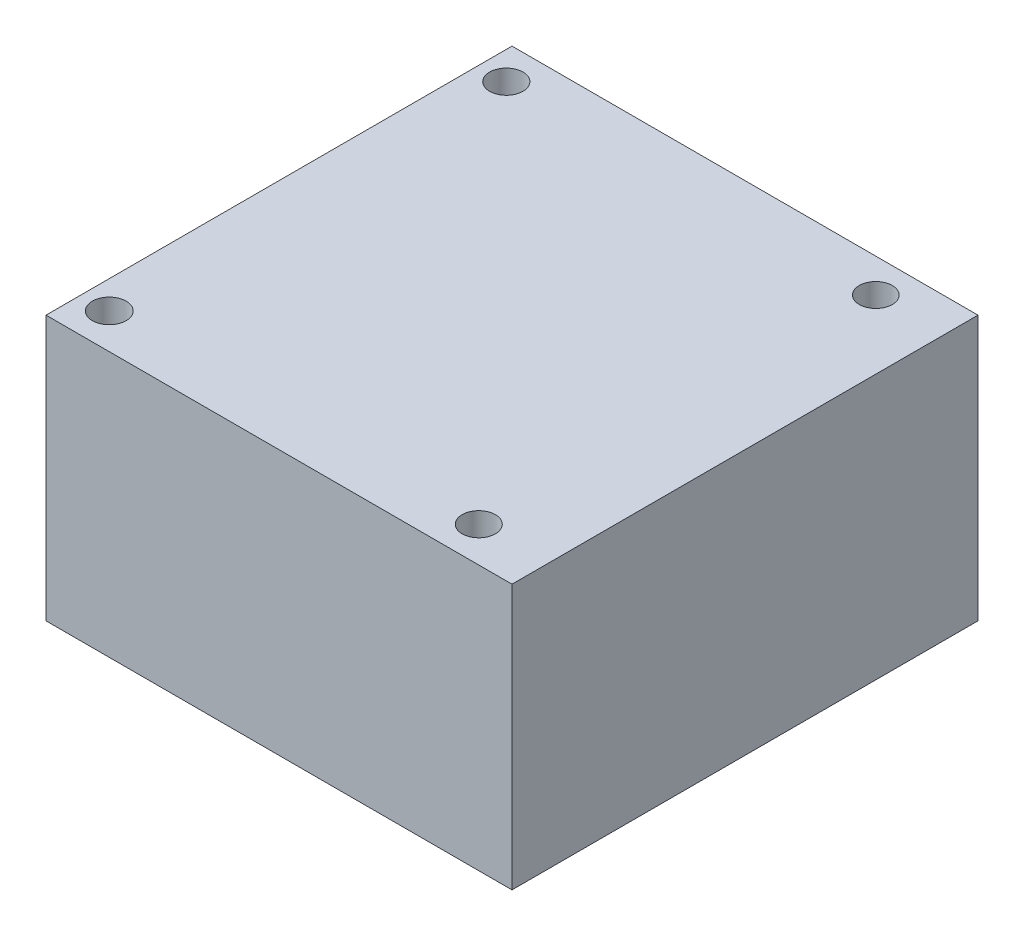
from build123d import *

# Parameters (mm, degrees)
SKETCH1_W           = 44
SKETCH1_H           = 44
BOSS_EXTRUDE1_DEPTH = 25
SKETCH2_R           = 1.559013533
SKETCH2_R_2         = 1.571081946
SKETCH2_R_3         = 1.598339627
SKETCH2_R_4         = 1.575214617
CUT_EXTRUDE1_DEPTH  = 30


with BuildPart() as part:
    # Sketch1 → Boss-Extrude1 (new body)
    with BuildSketch(Plane(origin=(0, 0, 0), x_dir=(1, 0, 0), z_dir=(0, 1, 0))):
        with Locations((0, -5.726027397)):
            Rectangle(SKETCH1_W, SKETCH1_H)
    extrude(amount=BOSS_EXTRUDE1_DEPTH)

    # Sketch2 → Cut-Extrude1 (cut)
    with BuildSketch(Plane(origin=(0, 25, 0), x_dir=(1, 0, 0), z_dir=(0, 1, 0))):
        with Locations((15.528578285, 13.093969639)):
            Circle(SKETCH2_R)
        with Locations((15.528578285, -24.392226848)):
            Circle(SKETCH2_R_2)
        with Locations((-19.358354609, -24.392226848)):
            Circle(SKETCH2_R_3)
        with Locations((-19.358354609, 13.093969639)):
            Circle(SKETCH2_R_4)
    extrude(amount=-CUT_EXTRUDE1_DEPTH, mode=Mode.SUBTRACT)


solid = part.part
